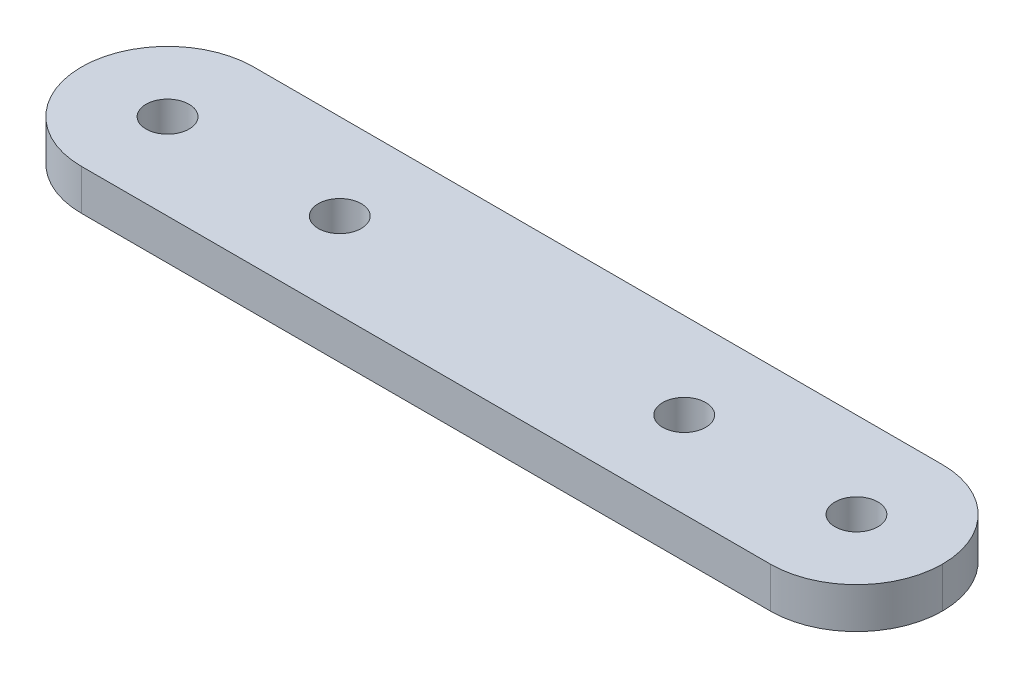
from build123d import *

# Parameters (mm, degrees)
SKETCH1_W           = 63.5
SKETCH1_H           = 12.7
SKETCH1_R           = 1.5875
BOSS_EXTRUDE1_DEPTH = 3
FILLET1_R           = 6.35


with BuildPart() as part:
    # Sketch1 → Boss-Extrude1 (new body)
    with BuildSketch(Plane(origin=(0, 0, 0), x_dir=(1, 0, 0), z_dir=(0, 1, 0))):
        Rectangle(SKETCH1_W, SKETCH1_H)
        with Locations(Location((-12.7, 0, 0), (0, 0, 270))):
            Circle(SKETCH1_R, mode=Mode.SUBTRACT)
        with Locations(Location((12.7, 0, 0), (0, 0, 270))):
            Circle(SKETCH1_R, mode=Mode.SUBTRACT)
        with Locations(Location((25.4, 0, 0), (0, 0, 270))):
            Circle(SKETCH1_R, mode=Mode.SUBTRACT)
        with Locations(Location((-25.4, 0, 0), (0, 0, 270))):
            Circle(SKETCH1_R, mode=Mode.SUBTRACT)
    extrude(amount=BOSS_EXTRUDE1_DEPTH)

    # Fillet1
    fillet1_edges = [part.edges().sort_by_distance(p)[0] for p in [
        (-31.75, 1.5, -6.35),
        (-31.75, 1.5, 6.35),
        (31.75, 1.5, -6.35),
        (31.75, 1.5, 6.35),
    ]]
    fillet(fillet1_edges, radius=FILLET1_R - 0.0001)  # a hair under: the kernel refuses the full size


solid = part.part
